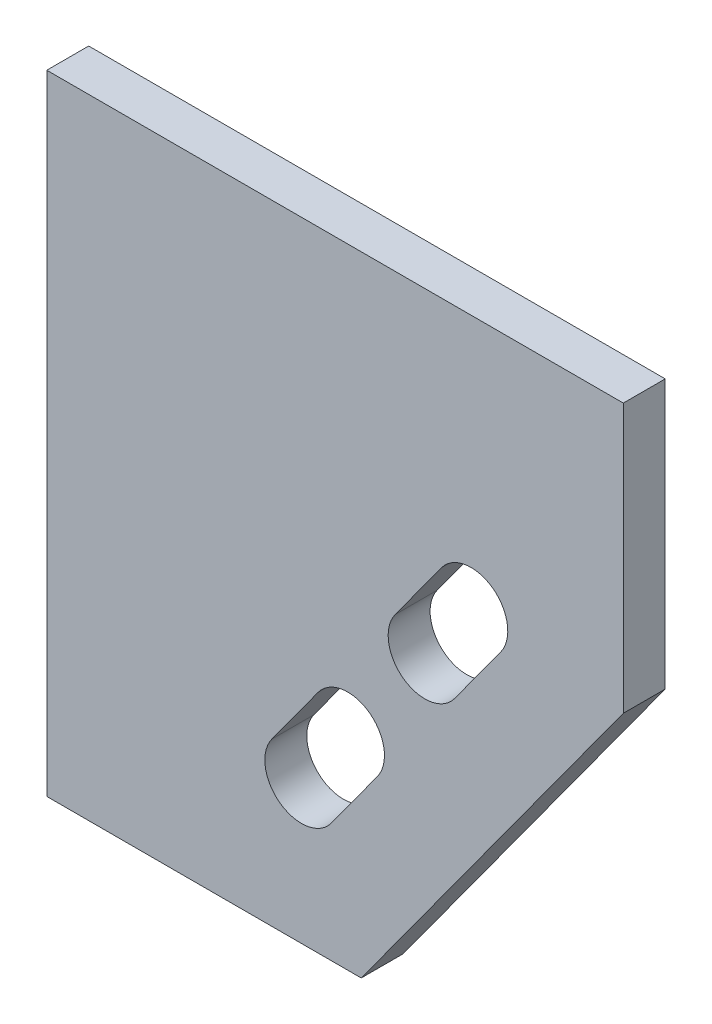
from build123d import *

# Parameters (mm, degrees)
SM_BASE_FLANGE_1_DEPTH = 8
CUT_EXTRUDE_1_DEPTH    = 10


# Sheet-metal steps are written as plain solids
with BuildPart() as part:
    # Sketch 1 → Базовая кромка1 (new body)
    with BuildSketch(Plane.XY):
        Polygon((0, 0), (0, 120), (110, 120), (110, 68.738635424), (60, 0), align=None)
    extrude(amount=-SM_BASE_FLANGE_1_DEPTH)

    # Эскиз6 → Вырез-Вытянуть1 (cut)
    with BuildSketch(Plane.XY):
        with BuildLine():
            Line((66.474866664, 63.30146998), (75.298396076, 75.431817408))
            ThreePointArc((75.298396076, 75.431817408), (85.076871934, 76.974999149), (86.620053675, 67.196523291))
            Line((86.620053675, 67.196523291), (77.796524263, 55.066175863))
            ThreePointArc((77.796524263, 55.066175863), (68.018048405, 53.522994122), (66.474866664, 63.30146998))
        make_face()
        with BuildLine():
            Line((51.768984311, 43.084224267), (42.945454899, 30.95387684))
            ThreePointArc((42.945454899, 30.95387684), (44.48863664, 21.175400981), (54.267112498, 22.718582722))
            Line((54.267112498, 22.718582722), (63.09064191, 34.84893015))
            ThreePointArc((63.09064191, 34.84893015), (61.547460169, 44.627406008), (51.768984311, 43.084224267))
        make_face()
    extrude(amount=-CUT_EXTRUDE_1_DEPTH, mode=Mode.SUBTRACT)


solid = part.part
